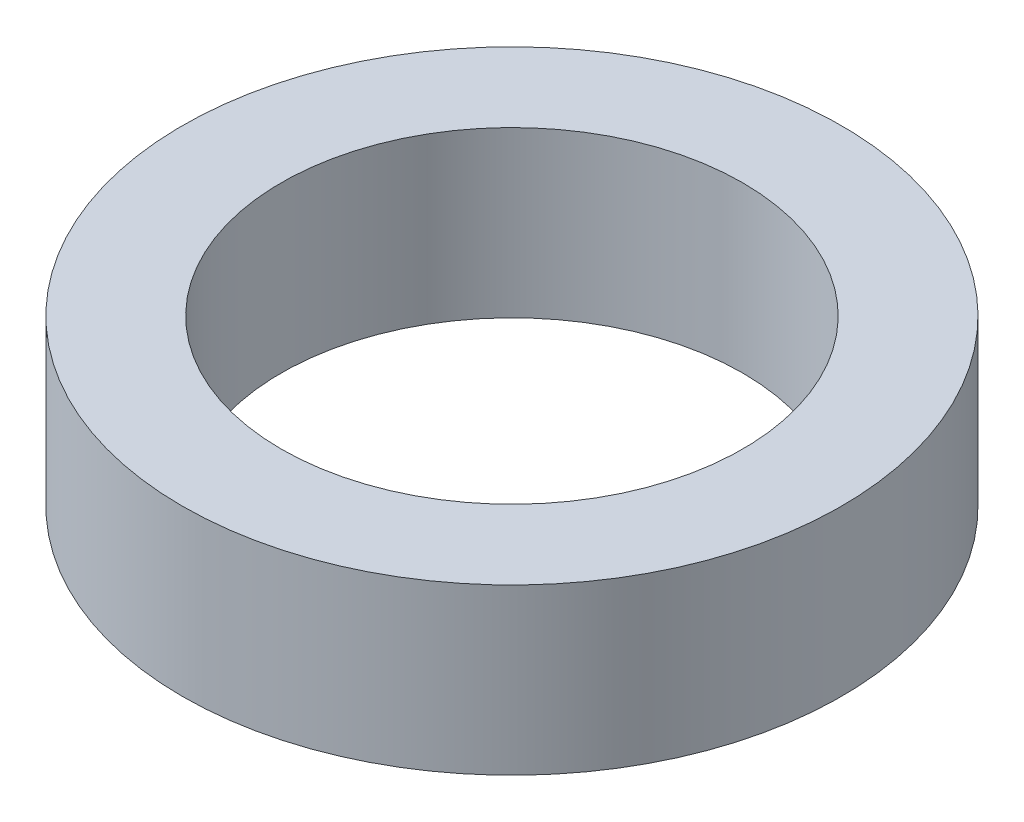
from build123d import *

# Parameters (mm, degrees)
SKETCH1_R           = 50
BOSS_EXTRUDE1_DEPTH = 25
SKETCH2_R           = 35
CUT_EXTRUDE1_DEPTH  = 76


with BuildPart() as part:
    # Sketch1 → Boss-Extrude1 (new body)
    with BuildSketch(Plane(origin=(0, 0, 0), x_dir=(1, 0, 0), z_dir=(0, 1, 0))):
        Circle(SKETCH1_R)
    extrude(amount=BOSS_EXTRUDE1_DEPTH)

    # Sketch2 → Cut-Extrude1 (cut, through all)
    with BuildSketch(Plane(origin=(0, 0, 0), x_dir=(1, 0, 0), z_dir=(0, 1, 0))):
        Circle(SKETCH2_R)
    extrude(amount=CUT_EXTRUDE1_DEPTH, mode=Mode.SUBTRACT)


solid = part.part
